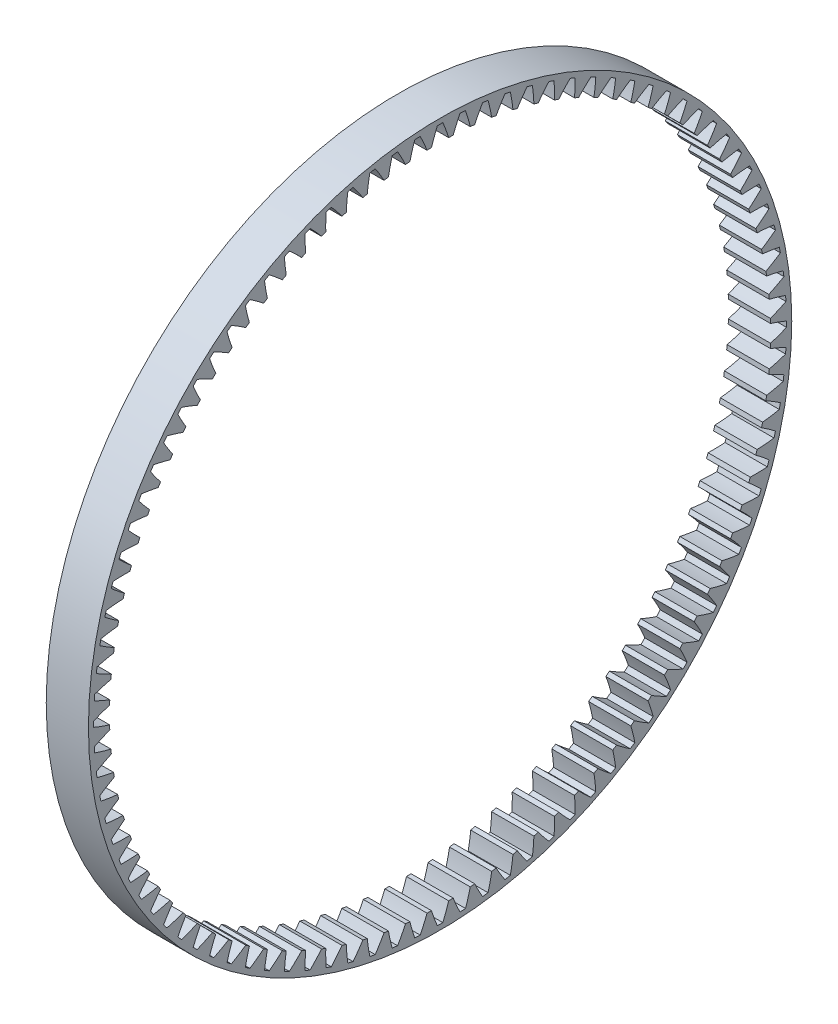
from build123d import *

# Parameters (mm, degrees)
BASPROSKE_W     = 3
BASPROSKE_H     = 1.5
TOOTHCUT_DEPTH  = 36.482389998
TEETHCUTS_COUNT = 96
TEETHCUTS_ANGLE = 356.25


with BuildPart() as part:
    # BasProSke → Base-Revolve (revolve)
    with BuildSketch(Plane(origin=(0, 0, 0), x_dir=(1, 0, 0), z_dir=(0, 1, 0))):
        with Locations((1.5, 24.25)):
            Rectangle(BASPROSKE_W, BASPROSKE_H)
    revolve(axis=Axis((-10, 0, 0), (1, 0, 0)))

    # TooCutSke → ToothCut (cut, through all)
    with BuildSketch(Plane(origin=(0, 0, 0), x_dir=(0, 0, -1), z_dir=(1, 0, 0))):
        with BuildLine():
            ThreePointArc((0.615875428, 23.46651961), (0.420230958, 24.051285543), (0.194806202, 24.625229472))
            ThreePointArc((0.194806202, 24.625229472), (0, 24.626), (-0.194806202, 24.625229472))
            ThreePointArc((-0.194806202, 24.625229472), (-0.420230958, 24.051285543), (-0.615875428, 23.46651961))
            ThreePointArc((-0.615875428, 23.46651961), (0, 23.4746), (0.615875428, 23.46651961))
        make_face()
    toothcut = extrude(amount=TOOTHCUT_DEPTH, mode=Mode.SUBTRACT)

    # TeethCuts: ToothCut ×96 about axis
    teethcuts_axis = Axis((-10, 0, 0), (1, 0, 0))
    for i in range(1, TEETHCUTS_COUNT):
        add(toothcut.rotate(teethcuts_axis, i * TEETHCUTS_ANGLE / (TEETHCUTS_COUNT - 1)), mode=Mode.SUBTRACT)


solid = part.part
